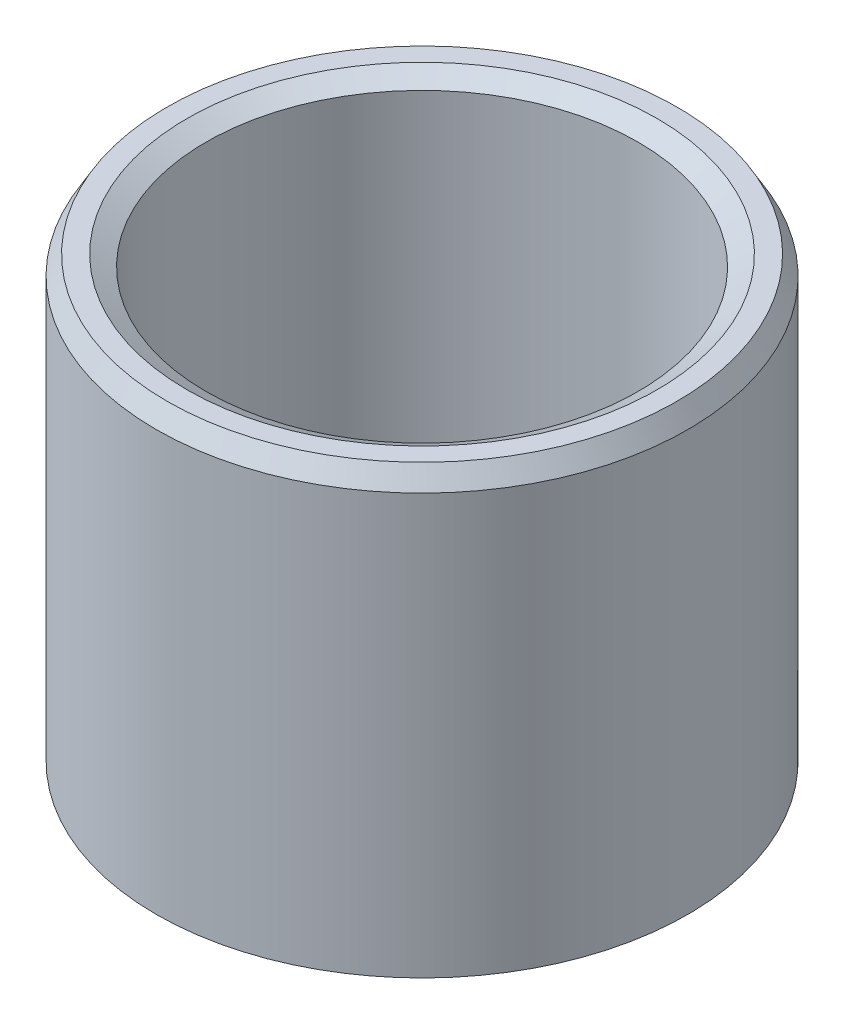
from build123d import *
from OCP.BRepFilletAPI import BRepFilletAPI_MakeChamfer

# Parameters (mm, degrees)
SKETCH1_R           = 15
BOSS_EXTRUDE1_DEPTH = 25.376951487
SKETCH2_R           = 12.188440105
CUT_EXTRUDE1_DEPTH  = 34.075514611
CHAMFER1_SIZE       = 1.070392956
CHAMFER1_SIZE2      = 0.617991661


with BuildPart() as part:
    # Sketch1 → Boss-Extrude1 (new body)
    with BuildSketch(Plane(origin=(0, 0, 0), x_dir=(1, 0, 0), z_dir=(0, 1, 0))):
        Circle(SKETCH1_R)
    extrude(amount=BOSS_EXTRUDE1_DEPTH)

    # Sketch2 → Cut-Extrude1 (cut, through all)
    with BuildSketch(Plane(origin=(0, 0, 0), x_dir=(1, 0, 0), z_dir=(0, 1, 0))):
        Circle(SKETCH2_R)
    extrude(amount=CUT_EXTRUDE1_DEPTH, mode=Mode.SUBTRACT)

    # Chamfer1: one chamfer whose edges measure the first distance from different faces: ONE call of the kernel's chamfer builder (chamfer() names one face for all edges)
    chamfer1_edges_1 = [part.edges().sort_by_distance(p)[0] for p in [
        (-12.188440105, 25.376951487, 0),
    ]]
    chamfer1_side_1 = [part.faces().sort_by_distance(p)[0] for p in [
        (-14.575735931, 25.376951487, 0),
    ]]
    chamfer1_edges_2 = [part.edges().sort_by_distance(p)[0] for p in [
        (-12.188440105, 0, 0),
    ]]
    chamfer1_side_2 = [part.faces().sort_by_distance(p)[0] for p in [
        (-12.188440105, 12.688475744, 0),
    ]]
    chamfer1_edges_3 = [part.edges().sort_by_distance(p)[0] for p in [
        (-15, 0, 0),
    ]]
    chamfer1_side_3 = [part.faces().sort_by_distance(p)[0] for p in [
        (-14.575735931, 0, 0),
    ]]
    chamfer1_edges_4 = [part.edges().sort_by_distance(p)[0] for p in [
        (-15, 25.376951487, 0),
    ]]
    chamfer1_side_4 = [part.faces().sort_by_distance(p)[0] for p in [
        (-15, 12.688475744, 0),
    ]]
    chamfer1 = BRepFilletAPI_MakeChamfer(part.part.solid().wrapped)
    for e in chamfer1_edges_1:
        chamfer1.Add(CHAMFER1_SIZE, CHAMFER1_SIZE2, e.wrapped, chamfer1_side_1[0].wrapped)  # the first distance lies on this face
    for e in chamfer1_edges_2:
        chamfer1.Add(CHAMFER1_SIZE, CHAMFER1_SIZE2, e.wrapped, chamfer1_side_2[0].wrapped)  # the first distance lies on this face
    for e in chamfer1_edges_3:
        chamfer1.Add(CHAMFER1_SIZE, CHAMFER1_SIZE2, e.wrapped, chamfer1_side_3[0].wrapped)  # the first distance lies on this face
    for e in chamfer1_edges_4:
        chamfer1.Add(CHAMFER1_SIZE, CHAMFER1_SIZE2, e.wrapped, chamfer1_side_4[0].wrapped)  # the first distance lies on this face
    add(Compound.cast(chamfer1.Shape()), mode=Mode.REPLACE)


solid = part.part
